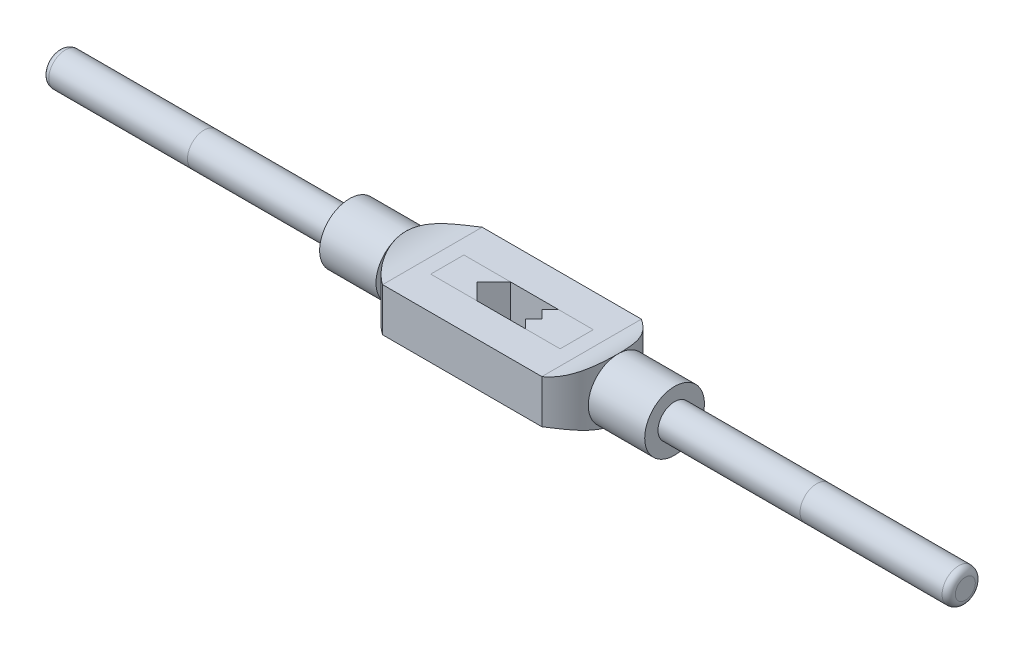
from build123d import *

# Parameters (mm, degrees)
FILLET1_R               = 2
BOSS_EXTRUDE1_DEPTH     = 15
CUT_EXTRUDE2_DEPTH      = 139.347479196
CUT_EXTRUDE2_DEPTH_BACK = 139.347479196
SPLIT1_START            = -6.55
SPLIT1_DEPTH            = 13.1
SPLIT1_START_2          = -19.5
SPLIT1_2_OUTLINE_W      = 13.1
SPLIT1_2_OUTLINE_H      = 10
SPLIT1_2_DEPTH          = 39
SPLIT1_3_DEPTH          = 13.1
SPLIT2_START            = -136.65
SPLIT2_2_OUTLINE_R      = 5
SPLIT2_2_DEPTH          = 43.825
SPLIT2_START_2          = 91.825
SPLIT2_3_OUTLINE_R      = 5
SPLIT2_3_DEPTH          = 44.825


# Read off the part's stored shape, not the designer's step: Revolve9, Split1, Split2
with BuildPart() as part:
    # Revolve9 outline → Revolve9 (revolve)
    with BuildSketch(Plane.YX):
        with BuildLine():
            Line((9, -49), (9, -32))
            ThreePointArc((9, -32), (7.176225033, -28.183374834), (6.55, -24))
            Line((6.55, -24), (6.55, 0))
            Line((6.55, 0), (0, 0))
            Line((0, 0), (0, -136.65))
            Line((0, -136.65), (5, -136.65))
            Line((5, -136.65), (5, -49))
            Line((5, -49), (9, -49))
        make_face()
    revolve(axis=Axis((0, 0, 0), (1, 0, 0)))

    # Fillet1
    fillet1_edges = [part.edges().sort_by_distance(p)[0] for p in [
        (-136.65, -5, 0),
    ]]
    fillet(fillet1_edges, radius=FILLET1_R)

    # Mirror1: part across plane


with BuildPart() as part_1:
    add(part.part)
    add(part.part.mirror(Plane(origin=(0, 0, 0), x_dir=(0, 0, 1), z_dir=(1, 0, 0))))

    # Sketch5 → Boss-Extrude1 (add, symmetric)
    with BuildSketch(Plane.XY):
        with BuildLine():
            Line((-24, 6.55), (24, 6.55))
            ThreePointArc((24, 6.55), (28.183374834, 7.176225033), (32, 9))
            Line((32, 9), (32, -9))
            ThreePointArc((32, -9), (28.183374834, -7.176225033), (24, -6.55))
            Line((24, -6.55), (-24, -6.55))
            ThreePointArc((-24, -6.55), (-28.183374834, -7.176225033), (-32, -9))
            Line((-32, -9), (-32, 9))
            ThreePointArc((-32, 9), (-28.183374834, 7.176225033), (-24, 6.55))
        make_face()
    extrude(amount=BOSS_EXTRUDE1_DEPTH, both=True)

    # Sketch6 → Cut-Extrude2 (cut, two sides: drawn at the far end of the back side and taken through both)
    with BuildSketch(Plane(origin=(0, 6.55, 0), x_dir=(1, 0, 0), z_dir=(0, 1, 0)).offset(-CUT_EXTRUDE2_DEPTH_BACK)):
        with BuildLine():
            Line((-32, 15), (-32, 0))
            ThreePointArc((-32, 0), (-29.875, 8.5), (-24, 15))
            Line((-24, 15), (-32, 15))
        make_face()
        with BuildLine():
            ThreePointArc((-32, 0), (-29.875, -8.5), (-24, -15))
            Line((-24, -15), (-32, -15))
            Line((-32, -15), (-32, 0))
        make_face()
        with BuildLine():
            ThreePointArc((24, -15), (29.875, -8.5), (32, 0))
            Line((32, 0), (32, -15))
            Line((32, -15), (24, -15))
        make_face()
        with BuildLine():
            ThreePointArc((32, 0), (29.875, 8.5), (24, 15))
            Line((24, 15), (32, 15))
            Line((32, 15), (32, 0))
        make_face()
        Polygon((9, 5), (-5.5, 5), (-10.5, 0), (-5.5, -5), (9, -5), (6.5, -2.5), (9, 0), (6.5, 2.5), align=None)
    extrude(amount=CUT_EXTRUDE2_DEPTH + CUT_EXTRUDE2_DEPTH_BACK, mode=Mode.SUBTRACT)


with BuildPart() as cut_extrude2_piece_1:
    # of the separate pieces the step leaves, piece 1, a body of its own (cut_extrude2_pieces)
    add(part_1.part.solids().sort_by_distance((-24, -6.55, -15))[0])

    # Split1 2 outline → Split1 2 (cut)
    with BuildSketch(Plane.YZ.offset(SPLIT1_START_2)):
        Rectangle(SPLIT1_2_OUTLINE_W, SPLIT1_2_OUTLINE_H)
    extrude(amount=SPLIT1_2_DEPTH, mode=Mode.SUBTRACT)


with BuildPart() as cut_extrude2_piece_2:
    # of the separate pieces the step leaves, piece 2, a body of its own (cut_extrude2_pieces)
    add(part_1.part.solids().sort_by_distance((-136.65, 3, 0))[0])

    # Split2 2 outline → Split2 2 (cut)
    with BuildSketch(Plane.YZ.offset(SPLIT2_START)):
        Circle(SPLIT2_2_OUTLINE_R)
    extrude(amount=SPLIT2_2_DEPTH, mode=Mode.SUBTRACT)


with BuildPart() as cut_extrude2_piece_3:
    # of the separate pieces the step leaves, piece 3, a body of its own (cut_extrude2_pieces)
    add(part_1.part.solids().sort_by_distance((49, 9, 0))[0])

    # Split2 3 outline → Split2 3 (cut)
    with BuildSketch(Plane.YZ.offset(SPLIT2_START_2)):
        Circle(SPLIT2_3_OUTLINE_R)
    extrude(amount=SPLIT2_3_DEPTH, mode=Mode.SUBTRACT)


with BuildPart() as body_4:
    # Split1 outline → Split1 (new body)
    with BuildSketch(Plane(origin=(0, 0, 0), x_dir=(1, 0, 0), z_dir=(0, 1, 0)).offset(SPLIT1_START)):
        Polygon((19.5, 5), (9, 5), (6.5, 2.5), (9, 0), (6.5, -2.5), (9, -5), (19.5, -5), align=None)
    extrude(amount=SPLIT1_DEPTH)


with BuildPart() as body_5:
    # Split1 3 outline → Split1 3 (new body)
    with BuildSketch(Plane(origin=(0, 0, 0), x_dir=(1, 0, 0), z_dir=(0, 1, 0)).offset(SPLIT1_START)):
        Polygon((-19.5, 5), (-19.5, -5), (-5.5, -5), (-10.5, 0), (-5.5, 5), align=None)
    extrude(amount=SPLIT1_3_DEPTH)


with BuildPart() as body_6:
    # Split2 outline → Split2 (revolve)
    with BuildSketch(Plane.YX):
        with BuildLine():
            Line((0, 136.65), (0, 91.825))
            Line((0, 91.825), (5, 91.825))
            Line((5, 91.825), (5, 134.65))
            ThreePointArc((5, 134.65), (4.414213562, 136.064213562), (3, 136.65))
            Line((3, 136.65), (0, 136.65))
        make_face()
    revolve(axis=Axis((0, 0, 0), (1, 0, 0)))


with BuildPart() as body_7:
    # Split2 4 outline → Split2 4 (revolve)
    with BuildSketch(Plane.YX):
        with BuildLine():
            Line((5, -92.825), (0, -92.825))
            Line((0, -92.825), (0, -136.65))
            Line((0, -136.65), (3, -136.65))
            ThreePointArc((3, -136.65), (4.414213562, -136.064213562), (5, -134.65))
            Line((5, -134.65), (5, -92.825))
        make_face()
    revolve(axis=Axis((0, 0, 0), (1, 0, 0)))


solid = Compound([cut_extrude2_piece_1.part, cut_extrude2_piece_2.part, cut_extrude2_piece_3.part, body_4.part, body_5.part, body_6.part, body_7.part])
